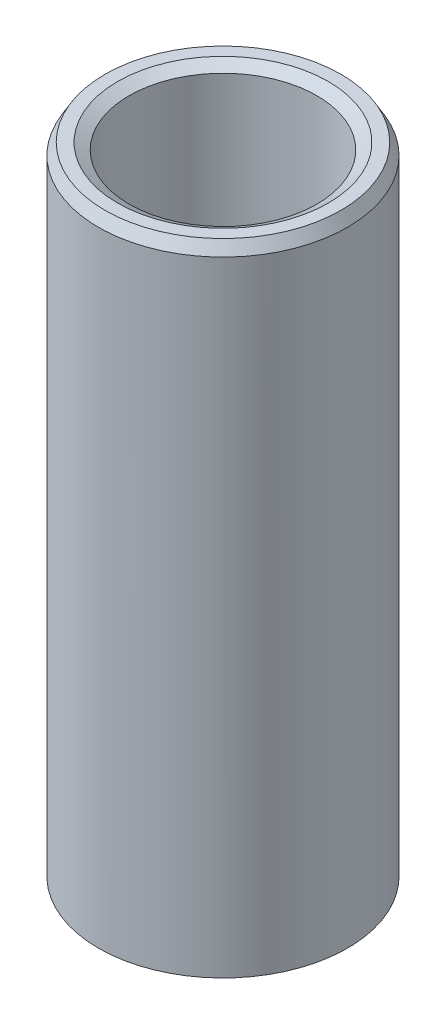
from build123d import *
from OCP.BRepFilletAPI import BRepFilletAPI_MakeChamfer

# Parameters (mm, degrees)
SKETCH1_R           = 42.5
BOSS_EXTRUDE1_DEPTH = 219.236649232
SKETCH2_R           = 32.060322945
CUT_EXTRUDE1_DEPTH  = 228.326215749
CHAMFER1_SIZE       = 3.892726929
CHAMFER1_SIZE2      = 2.247466941


with BuildPart() as part:
    # Sketch1 → Boss-Extrude1 (new body)
    with BuildSketch(Plane(origin=(0, 0, 0), x_dir=(1, 0, 0), z_dir=(0, 1, 0))):
        Circle(SKETCH1_R)
    extrude(amount=BOSS_EXTRUDE1_DEPTH)

    # Sketch2 → Cut-Extrude1 (cut, through all)
    with BuildSketch(Plane(origin=(0, 0, 0), x_dir=(1, 0, 0), z_dir=(0, 1, 0))):
        Circle(SKETCH2_R)
    extrude(amount=CUT_EXTRUDE1_DEPTH, mode=Mode.SUBTRACT)

    # Chamfer1: one chamfer whose edges measure the first distance from different faces: ONE call of the kernel's chamfer builder (chamfer() names one face for all edges)
    chamfer1_edges_1 = [part.edges().sort_by_distance(p)[0] for p in [
        (-32.060322945, 219.236649232, 0),
    ]]
    chamfer1_side_1 = [part.faces().sort_by_distance(p)[0] for p in [
        (-41.297918472, 219.236649232, 0),
    ]]
    chamfer1_edges_2 = [part.edges().sort_by_distance(p)[0] for p in [
        (-32.060322945, 0, 0),
    ]]
    chamfer1_side_2 = [part.faces().sort_by_distance(p)[0] for p in [
        (-32.060322945, 109.618324616, 0),
    ]]
    chamfer1_edges_3 = [part.edges().sort_by_distance(p)[0] for p in [
        (-42.5, 0, 0),
    ]]
    chamfer1_side_3 = [part.faces().sort_by_distance(p)[0] for p in [
        (-41.297918472, 0, 0),
    ]]
    chamfer1_edges_4 = [part.edges().sort_by_distance(p)[0] for p in [
        (-42.5, 219.236649232, 0),
    ]]
    chamfer1_side_4 = [part.faces().sort_by_distance(p)[0] for p in [
        (-42.5, 109.618324616, 0),
    ]]
    chamfer1 = BRepFilletAPI_MakeChamfer(part.part.solid().wrapped)
    for e in chamfer1_edges_1:
        chamfer1.Add(CHAMFER1_SIZE, CHAMFER1_SIZE2, e.wrapped, chamfer1_side_1[0].wrapped)  # the first distance lies on this face
    for e in chamfer1_edges_2:
        chamfer1.Add(CHAMFER1_SIZE, CHAMFER1_SIZE2, e.wrapped, chamfer1_side_2[0].wrapped)  # the first distance lies on this face
    for e in chamfer1_edges_3:
        chamfer1.Add(CHAMFER1_SIZE, CHAMFER1_SIZE2, e.wrapped, chamfer1_side_3[0].wrapped)  # the first distance lies on this face
    for e in chamfer1_edges_4:
        chamfer1.Add(CHAMFER1_SIZE, CHAMFER1_SIZE2, e.wrapped, chamfer1_side_4[0].wrapped)  # the first distance lies on this face
    add(Compound.cast(chamfer1.Shape()), mode=Mode.REPLACE)


solid = part.part
